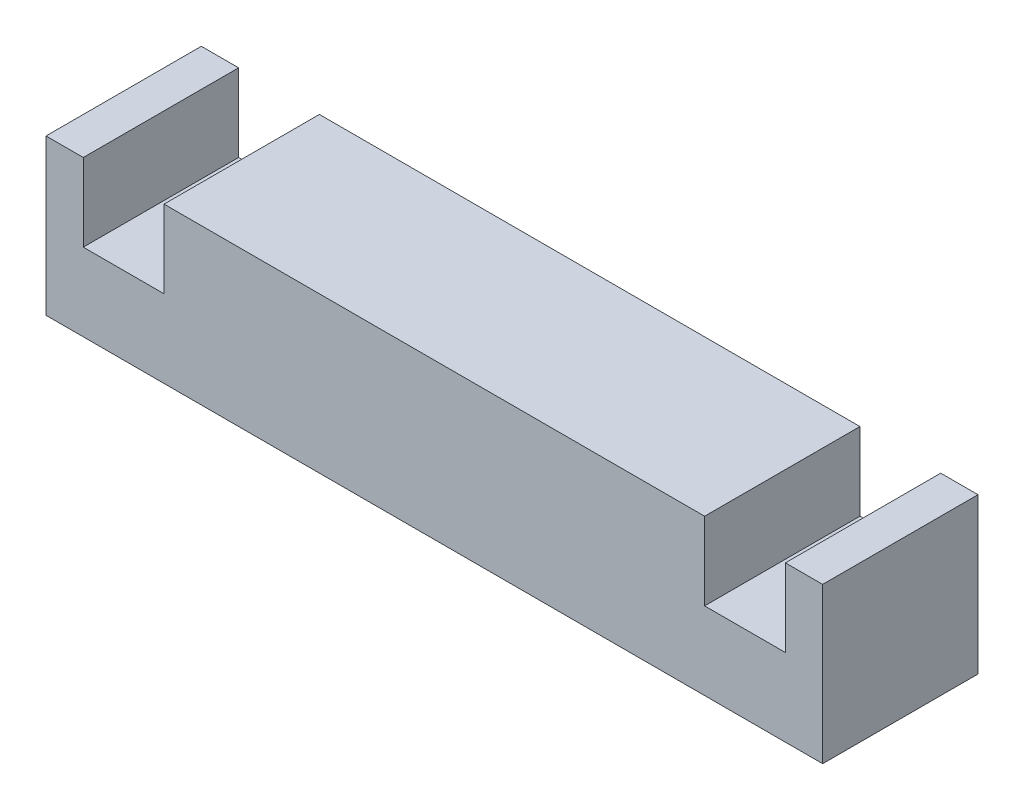
from build123d import *

# Parameters (mm, degrees)
SKETCH1_W                 = 50
SKETCH1_H                 = 10
BOSS_EXTRUDE1_DEPTH       = 10
M4X0_7_TAPPED_HOLE1_D     = 3.3
M4X0_7_TAPPED_HOLE1_DEPTH = 8
M4X0_7_TAPPED_HOLE1_TIP   = 0.991420021
M3X0_5_TAPPED_HOLE1_D     = 2.5
SKETCH6_W                 = 5.2
SKETCH6_H                 = 5
CUT_EXTRUDE1_DEPTH        = 10


with BuildPart() as part:
    # Sketch1 → Boss-Extrude1 (new body)
    with BuildSketch(Plane.XY):
        Rectangle(SKETCH1_W, SKETCH1_H)
    extrude(amount=BOSS_EXTRUDE1_DEPTH)

    # M4x0.7 Tapped Hole1
    with Locations(Plane(origin=(0, 0, 0), x_dir=(-1, 0, 0), z_dir=(0, 0, -1))):
        with Locations((-15, 0), (15, 0)):
            Hole(M4X0_7_TAPPED_HOLE1_D / 2, depth=M4X0_7_TAPPED_HOLE1_DEPTH)
            with Locations((0, 0, -(M4X0_7_TAPPED_HOLE1_DEPTH + M4X0_7_TAPPED_HOLE1_TIP / 2))):  # 118° drill point
                Cone(0, M4X0_7_TAPPED_HOLE1_D / 2, M4X0_7_TAPPED_HOLE1_TIP, mode=Mode.SUBTRACT)

    # M3x0.5 Tapped Hole1 (through all)
    with Locations(Plane(origin=(0, 5, 0), x_dir=(1, 0, 0), z_dir=(0, 1, 0))):
        with Locations((-20, -5), (20, -5)):
            Hole(M3X0_5_TAPPED_HOLE1_D / 2)

    # Sketch6 → Cut-Extrude1 (cut)
    with BuildSketch(Plane.XY.offset(10)):
        with Locations((-20, 2.5)):
            Rectangle(SKETCH6_W, SKETCH6_H)
    cut_extrude1 = extrude(amount=-CUT_EXTRUDE1_DEPTH, mode=Mode.SUBTRACT)

    # Mirror1: Cut-Extrude1 across plane
    add(cut_extrude1.mirror(Plane(origin=(0, 0, 0), x_dir=(0, 0, 1), z_dir=(1, 0, 0))), mode=Mode.SUBTRACT)


solid = part.part
